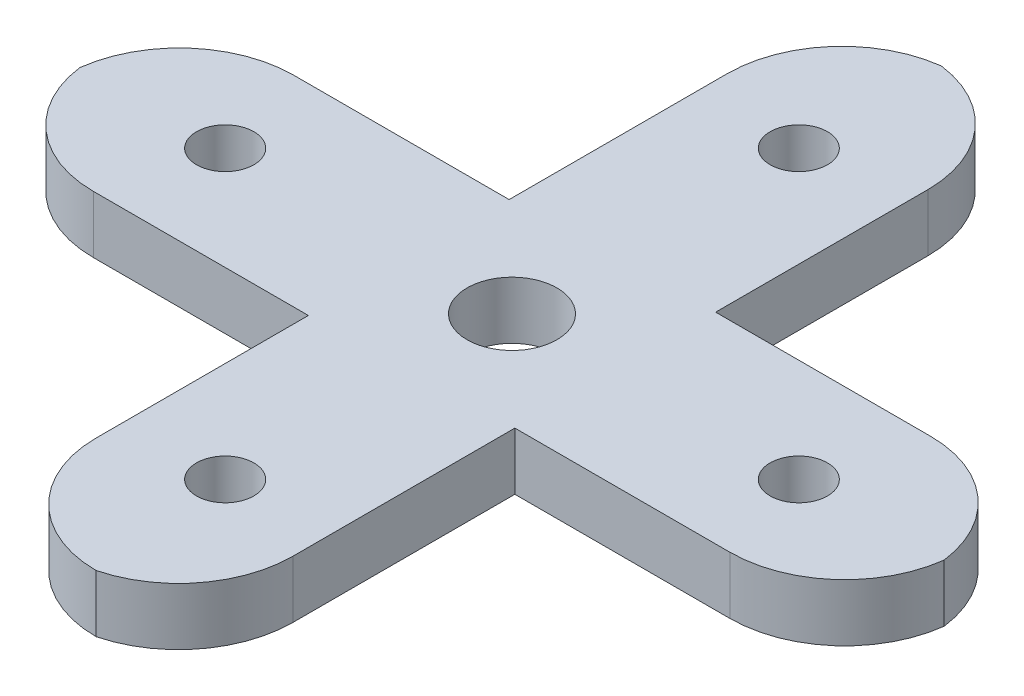
from build123d import *

# Parameters (mm, degrees)
BOSS_EXTRUDE1_DEPTH = 2.54
FILLET1_R           = 5.08
FILLET2_R           = 5.08
SKETCH2_R           = 1.989538673
SKETCH2_R_2         = 1.27
CUT_EXTRUDE1_DEPTH  = 2.54


with BuildPart() as part:
    # Sketch1 → Boss-Extrude1 (new body)
    with BuildSketch(Plane(origin=(0, 0, 0), x_dir=(1, 0, 0), z_dir=(0, 1, 0))):
        Polygon((-4.200769231, 17.994923077), (-4.200769231, 3.262923077), (-18.805769231, 3.262923077), (-18.805769231, -5.627076923), (-4.200769231, -5.627076923), (-4.200769231, -20.105076923), (4.689230769, -20.105076923), (4.689230769, -5.373076923), (19.294230769, -5.373076923), (19.294230769, 3.516923077), (4.689230769, 3.516923077), (4.689230769, 17.994923077), align=None)
    extrude(amount=BOSS_EXTRUDE1_DEPTH)

    # Fillet1
    fillet1_edges = [part.edges().sort_by_distance(p)[0] for p in [
        (-4.200769231, 1.27, 20.105076923),
    ]]
    fillet(fillet1_edges, radius=FILLET1_R)

    # Fillet2
    # the kernel refuses this fillet: 5.08 mm, written as the material it takes off along each edge
    with BuildSketch(Plane(origin=(-4.200769231, -12.7, -17.994923077), x_dir=(0, 0, 1), z_dir=(0, 1, 0)), Plane(origin=(-18.805769231, -12.7, -3.262923077), x_dir=(0, 0, 1), z_dir=(0, 1, 0)), Plane(origin=(-18.805769231, -12.7, 5.627076923), x_dir=(1, 0, 0), z_dir=(0, 1, 0)), Plane(origin=(4.689230769, -12.7, -17.994923077), x_dir=(-1, 0, 0), z_dir=(0, 1, 0))) as fillet2_piece_1:
        with BuildLine():
            CenterArc((FILLET2_R, FILLET2_R), FILLET2_R, 180, 90)
            Line((0, FILLET2_R), (-FILLET2_R * 0.02, FILLET2_R))
            Line((-FILLET2_R * 0.02, FILLET2_R), (-FILLET2_R * 0.02, -FILLET2_R * 0.02))
            Line((-FILLET2_R * 0.02, -FILLET2_R * 0.02), (FILLET2_R, -FILLET2_R * 0.02))
            Line((FILLET2_R, -FILLET2_R * 0.02), (FILLET2_R, 0))
        make_face()
    extrude(amount=27.94, mode=Mode.SUBTRACT)
    with BuildSketch(Plane(origin=(19.294230769, -12.7, -3.516923077), x_dir=(0, 0, 1), z_dir=(0, 1, 0)), Plane(origin=(19.294230769, -12.7, 5.373076923), x_dir=(-1, 0, 0), z_dir=(0, 1, 0))) as fillet2_piece_2:
        with BuildLine():
            CenterArc((FILLET2_R, -FILLET2_R), FILLET2_R, 90, 90)
            Line((0, -FILLET2_R), (-FILLET2_R * 0.02, -FILLET2_R))
            Line((-FILLET2_R * 0.02, -FILLET2_R), (-FILLET2_R * 0.02, FILLET2_R * 0.02))
            Line((-FILLET2_R * 0.02, FILLET2_R * 0.02), (FILLET2_R, FILLET2_R * 0.02))
            Line((FILLET2_R, FILLET2_R * 0.02), (FILLET2_R, 0))
        make_face()
    extrude(amount=27.94, mode=Mode.SUBTRACT)
    with BuildSketch(Plane(origin=(4.689230769, -12.296722124, 20.105076923), x_dir=(-1, 0, 0), z_dir=(0, 1, 0))) as fillet2_piece_3:
        with BuildLine():
            CenterArc((5.08, -4.91868885), FILLET2_R, 104.477512186, 75.522487814)
            Line((0, -4.91868885), (-0.1016, -4.91868885))
            Line((-0.1016, -4.91868885), (-0.1016, 0))
            Line((-0.1016, 0), (0, 0.1016))
            ThreePointArc((0, 0.1016), (1.905, 0.1016), (3.7846, 0.098373777))
            Line((3.7846, 0.098373777), (3.81, 0))
        make_face()
    extrude(amount=27.133444248, mode=Mode.SUBTRACT)

    # Sketch2 → Cut-Extrude1 (cut)
    with BuildSketch(Plane(origin=(0, 2.54, 0), x_dir=(1, 0, 0), z_dir=(0, 1, 0))):
        with Locations(Location((0.244230769, -1.055076923, 0), (0, 0, 270))):
            Circle(SKETCH2_R)
        with Locations(Location((0.244230769, 11.644923077, 0), (0, 0, 270))):
            Circle(SKETCH2_R_2)
        with Locations(Location((0.244230769, -13.755076923, 0), (0, 0, 270))):
            Circle(SKETCH2_R_2)
        with Locations(Location((-12.455769231, -1.055076923, 0), (0, 0, 270))):
            Circle(SKETCH2_R_2)
        with Locations(Location((12.944230769, -1.055076923, 0), (0, 0, 270))):
            Circle(SKETCH2_R_2)
    extrude(amount=-CUT_EXTRUDE1_DEPTH, mode=Mode.SUBTRACT)


solid = part.part
